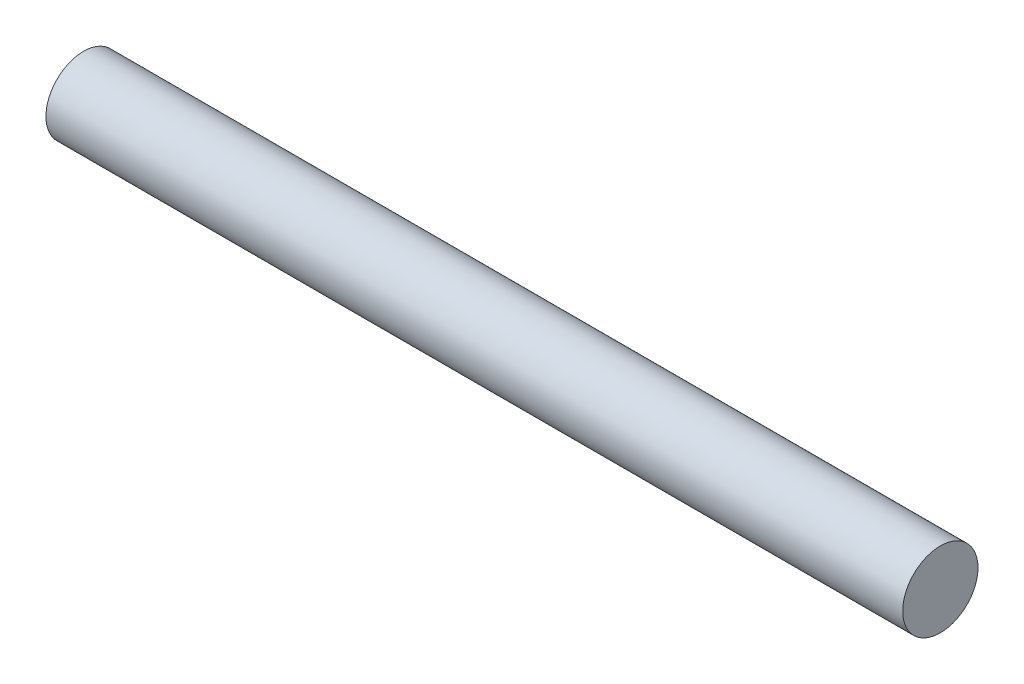
from build123d import *

# Parameters (mm, degrees)
SKETCH1_R           = 25.4
BOSS_EXTRUDE1_DEPTH = 577.85


with BuildPart() as part:
    # Sketch1 → Boss-Extrude1 (new body)
    with BuildSketch(Plane(origin=(0, 0, 0), x_dir=(0, 0, -1), z_dir=(1, 0, 0))):
        Circle(SKETCH1_R)
    extrude(amount=BOSS_EXTRUDE1_DEPTH)


solid = part.part
